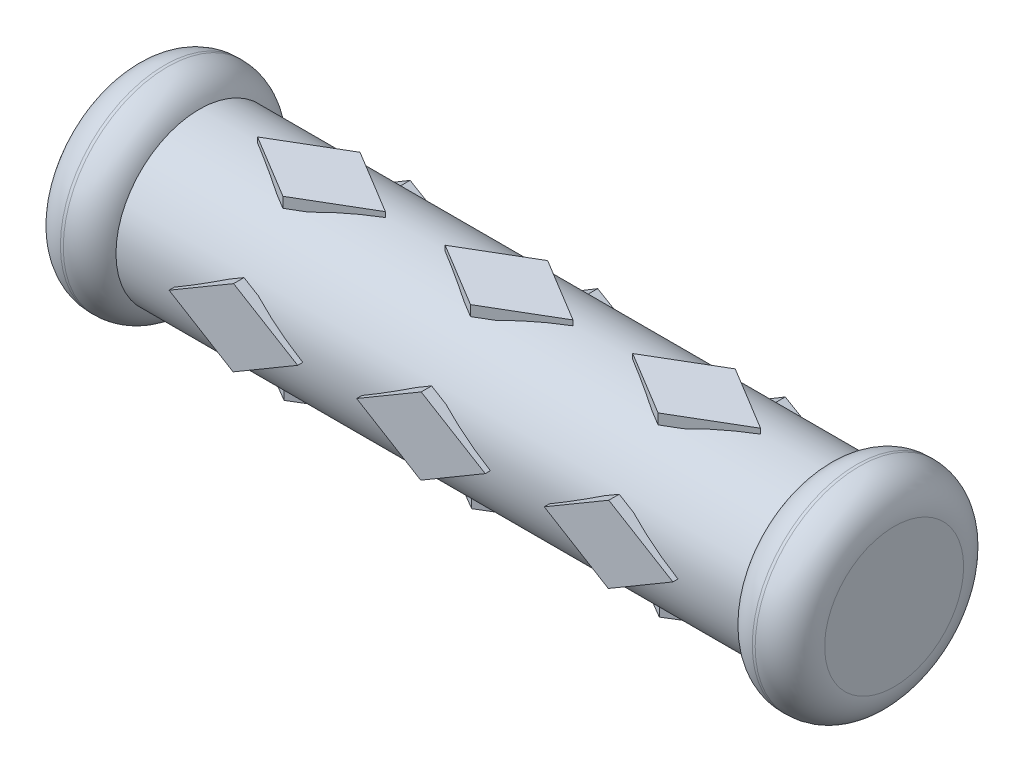
from build123d import *

# Parameters (mm, degrees)
CROQUIS1_R              = 12
SALIENTE_EXTRUIR1_DEPTH = 110
CROQUIS3_R              = 11
CORTAR_EXTRUIR1_DEPTH   = 110
CROQUIS4_R              = 15
SALIENTE_EXTRUIR3_DEPTH = 10
REDONDEO1_R             = 5
SALIENTE_EXTRUIR4_START = -10
CROQUIS5_R              = 15
SALIENTE_EXTRUIR4_DEPTH = 10
REDONDEO2_R             = 5
CORTAR_EXTRUIR2_START   = -100
CROQUIS7_R              = 11
CORTAR_EXTRUIR2_DEPTH   = 100
SALIENTE_EXTRUIR5_DEPTH = 0.75
MATRIZC1_COUNT          = 4


with BuildPart() as part:
    # Croquis1 → Saliente-Extruir1 (new body)
    with BuildSketch(Plane(origin=(0, 0, 0), x_dir=(0, 0, -1), z_dir=(1, 0, 0))):
        Circle(CROQUIS1_R)
    extrude(amount=SALIENTE_EXTRUIR1_DEPTH)

    # Croquis3 → Cortar-Extruir1 (cut)
    with BuildSketch(Plane(origin=(110, 0, 0), x_dir=(0, 0, -1), z_dir=(1, 0, 0))):
        Circle(CROQUIS3_R)
    extrude(amount=-CORTAR_EXTRUIR1_DEPTH, mode=Mode.SUBTRACT)

    # Croquis4 → Saliente-Extruir3 (add)
    with BuildSketch(Plane(origin=(110, 0, 0), x_dir=(0, 0, -1), z_dir=(1, 0, 0))):
        Circle(CROQUIS4_R)
    extrude(amount=-SALIENTE_EXTRUIR3_DEPTH)

    # Redondeo1
    # the kernel refuses this fillet: 5 mm, written as the material it takes off along each edge
    with BuildSketch(Plane(origin=(110, 0, 0), x_dir=(0, 0, -1), z_dir=(0, -1, 0))) as redondeo1_piece_1:
        with BuildLine():
            CenterArc((15 - REDONDEO1_R, -REDONDEO1_R), REDONDEO1_R, 0, 90)
            Line((15 - REDONDEO1_R, 0), (15 - REDONDEO1_R, REDONDEO1_R * 0.02))
            Line((15 - REDONDEO1_R, REDONDEO1_R * 0.02), (15 + REDONDEO1_R * 0.02, REDONDEO1_R * 0.02))
            Line((15 + REDONDEO1_R * 0.02, REDONDEO1_R * 0.02), (15 + REDONDEO1_R * 0.02, -REDONDEO1_R))
            Line((15 + REDONDEO1_R * 0.02, -REDONDEO1_R), (15, -REDONDEO1_R))
        make_face()
    revolve(axis=Axis((110, 0, 0), (1, 0, 0)), mode=Mode.SUBTRACT)
    with BuildSketch(Plane(origin=(100, 0, 0), x_dir=(0, 0, -1), z_dir=(0, -1, 0))) as redondeo1_piece_2:
        with BuildLine():
            CenterArc((10, 4.582575695), REDONDEO1_R, 293.578178478, 66.421821522)
            Line((15, 4.582575695), (15.1, 4.582575695))
            Line((15.1, 4.582575695), (15.1, 0))
            Line((15.1, 0), (15, -0.1))
            ThreePointArc((15, -0.1), (13.5, -0.1), (12.04, -0.091651514))
            Line((12.04, -0.091651514), (12, 0))
        make_face()
    revolve(axis=Axis((100, 0, 0), (1, 0, 0)), mode=Mode.SUBTRACT)

    # Croquis5 → Saliente-Extruir4 (add)
    with BuildSketch(Plane.ZY.offset(SALIENTE_EXTRUIR4_START)):
        with Locations(Location((0, 0, 0), (0, 0, 180))):
            Circle(CROQUIS5_R)
    extrude(amount=SALIENTE_EXTRUIR4_DEPTH)

    # Redondeo2
    # the kernel refuses this fillet: 5 mm, written as the material it takes off along each edge
    with BuildSketch(Plane(origin=(0, 0, 0), x_dir=(0, 0, -1), z_dir=(0, 1, 0))) as redondeo2_piece_1:
        with BuildLine():
            CenterArc((15 - REDONDEO2_R, -REDONDEO2_R), REDONDEO2_R, 0, 90)
            Line((15, -REDONDEO2_R), (15 + REDONDEO2_R * 0.02, -REDONDEO2_R))
            Line((15 + REDONDEO2_R * 0.02, -REDONDEO2_R), (15 + REDONDEO2_R * 0.02, REDONDEO2_R * 0.02))
            Line((15 + REDONDEO2_R * 0.02, REDONDEO2_R * 0.02), (15 - REDONDEO2_R, REDONDEO2_R * 0.02))
            Line((15 - REDONDEO2_R, REDONDEO2_R * 0.02), (15 - REDONDEO2_R, 0))
        make_face()
    revolve(axis=Axis((0, 0, 0), (-1, 0, 0)), mode=Mode.SUBTRACT)
    with BuildSketch(Plane(origin=(10, 0, 0), x_dir=(0, 0, -1), z_dir=(0, 1, 0))) as redondeo2_piece_2:
        with BuildLine():
            CenterArc((10, 4.582575695), REDONDEO2_R, 293.578178478, 66.421821522)
            Line((12, 0), (12.04, -0.091651514))
            ThreePointArc((12.04, -0.091651514), (13.5, -0.1), (15, -0.1))
            Line((15, -0.1), (15.1, 0))
            Line((15.1, 0), (15.1, 4.582575695))
            Line((15.1, 4.582575695), (15, 4.582575695))
        make_face()
    revolve(axis=Axis((10, 0, 0), (-1, 0, 0)), mode=Mode.SUBTRACT)

    # Croquis7 → Cortar-Extruir2 (cut)
    with BuildSketch(Plane.ZY.offset(CORTAR_EXTRUIR2_START)):
        with Locations(Location((0, 0, 0), (0, 0, 180))):
            Circle(CROQUIS7_R)
    extrude(amount=CORTAR_EXTRUIR2_DEPTH, mode=Mode.SUBTRACT)

    # Croquis9 → Saliente-Extruir5 (add, symmetric)
    with BuildSketch(Plane.XY.offset(11.985010852)):
        Polygon((18.375194252, 0), (27.66376902, 5.462495064), (36.886888429, -0.109806246), (27.598313662, -5.57230131), align=None)
        Polygon((45.375194252, 0), (54.66376902, 5.462495064), (63.886888429, -0.109806246), (54.598313662, -5.57230131), align=None)
        Polygon((72.375194252, 0), (81.66376902, 5.462495064), (90.886888429, -0.109806246), (81.598313662, -5.57230131), align=None)
    saliente_extruir5 = extrude(amount=SALIENTE_EXTRUIR5_DEPTH, both=True)

    # MatrizC1: Saliente-Extruir5 ×4 about axis
    matrizc1_axis = Axis((0, 0, 0), (1, 0, 0))
    for i in range(1, MATRIZC1_COUNT):
        add(saliente_extruir5.rotate(matrizc1_axis, i * 360 / MATRIZC1_COUNT))


solid = part.part
